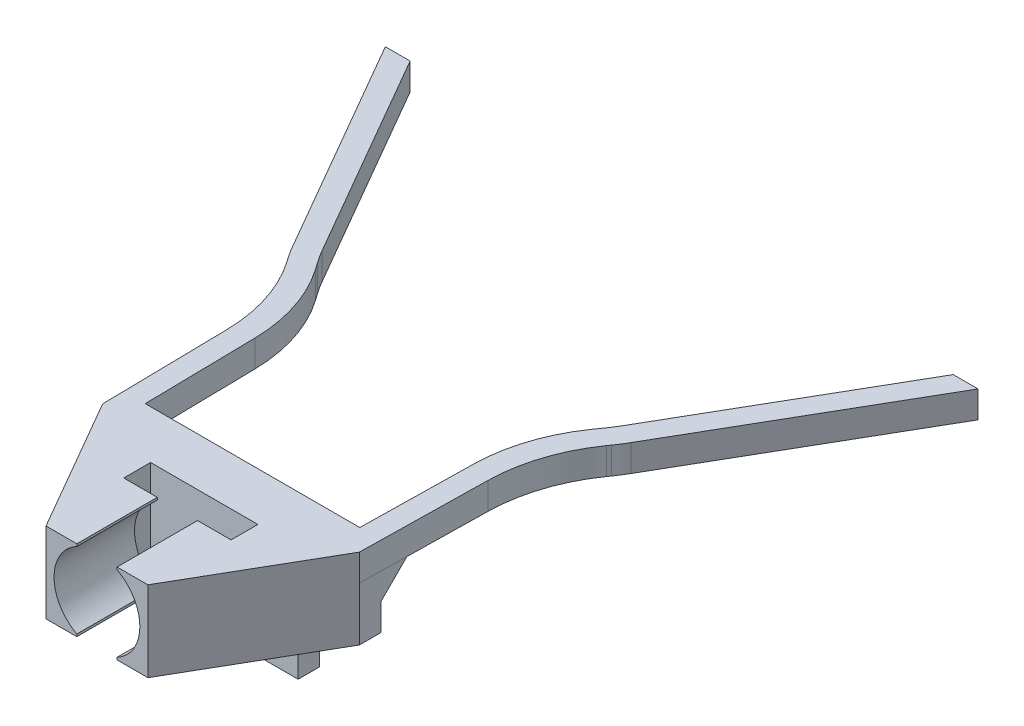
from build123d import *
from OCP.BRepFilletAPI import BRepFilletAPI_MakeChamfer

# Parameters (mm, degrees)
BOSS_EXTRUDE1_DEPTH             = 1
BOSS_EXTRUDE2_REACH             = 42.227
SKETCH2_W                       = 19.144631242
SKETCH2_H                       = 6
BOSS_EXTRUDE2_DIRECTION_2_DEPTH = 10
CUT_EXTRUDE1_DEPTH              = 8
CUT_EXTRUDE2_DEPTH              = 40.207813431
CUT_EXTRUDE2_DEPTH_BACK         = 40.207813431
SKETCH4_W                       = 8
SKETCH4_H                       = 2
CHAMFER1_SIZE                   = 2
CHAMFER2_SIZE                   = 10
CHAMFER2_SIZE2                  = 5.773502692
FILLET1_START                   = -1
FILLET1_DEPTH                   = 3
FILLET1_2_DEPTH                 = 2
BOSS_EXTRUDE3_START             = -6
SKETCH5_W                       = 10
SKETCH5_H                       = 1.6
BOSS_EXTRUDE3_DEPTH             = 10.5


with BuildPart() as part:
    # Sketch1 → Boss-Extrude1 (new, symmetric)
    with BuildSketch(Plane(origin=(0, 0, 0), x_dir=(1, 0, 0), z_dir=(0, 1, 0))):
        Polygon((-8, 0), (0, 0), (0, -1.6), (-9.572315621, -1.6), (-9.800648012, 11.481153904), (-12.360970922, 15.137673965), (-22.096439397, 32), (-20.248918536, 32), (-11.01025903, 15.998172342), (-8.209428877, 11.998172342), align=None)
    boss_extrude1 = extrude(amount=BOSS_EXTRUDE1_DEPTH, both=True)

    # Mirror1: Boss-Extrude1 across plane
    add(boss_extrude1.mirror(Plane(origin=(0, 1, 0), x_dir=(0, 0, 1), z_dir=(-1, 0, 0))))

    # Boss-Extrude2: up to this face of the body (flat: up to its plane)
    boss_extrude2_end = Plane(part.part.faces().sort_by_distance((0, 0, 0))[0])
    # Sketch2 → Boss-Extrude2 (add, up to the picked face)
    with BuildSketch(Plane.XY.offset(1.6), mode=Mode.PRIVATE) as boss_extrude2_sk1:
        with Locations((0, -2)):
            Rectangle(SKETCH2_W, SKETCH2_H)
    boss_extrude2_tool1 = split(extrude(boss_extrude2_sk1.sketch, amount=-BOSS_EXTRUDE2_REACH, mode=Mode.PRIVATE), bisect_by=boss_extrude2_end, keep=Keep.BOTH, mode=Mode.PRIVATE)
    add(boss_extrude2_tool1.solids().sort_by(Axis((0, -2, 1.6), (0, 0, -1)))[0])

    # Sketch2 → Boss-Extrude2 direction 2 (add)
    with BuildSketch(Plane.XY.offset(1.6)):
        with Locations((0, -2)):
            Rectangle(SKETCH2_W, SKETCH2_H)
    extrude(amount=BOSS_EXTRUDE2_DIRECTION_2_DEPTH)

    # Sketch3 → Cut-Extrude1 (cut)
    with BuildSketch(Plane.XY.offset(11.6)):
        with BuildLine():
            Line((-1.5, 0.826658805), (-1.5, 1))
            Line((-1.5, 1), (1.5, 1))
            Line((1.5, 1), (1.5, 0.826658805))
            ThreePointArc((1.5, 0.826658805), (3.2, -2), (1.5, -4.826658805))
            Line((1.5, -4.826658805), (1.5, -5))
            Line((1.5, -5), (-1.5, -5))
            Line((-1.5, -5), (-1.5, -4.826658805))
            ThreePointArc((-1.5, -4.826658805), (-3.2, -2), (-1.5, 0.826658805))
        make_face()
    extrude(amount=-CUT_EXTRUDE1_DEPTH, mode=Mode.SUBTRACT)

    # Sketch4 → Cut-Extrude2 (cut, two sides: drawn at the far end of the back side and taken through both)
    with BuildSketch(Plane(origin=(0, 0, 0), x_dir=(1, 0, 0), z_dir=(0, 1, 0)).offset(-CUT_EXTRUDE2_DEPTH_BACK)):
        with Locations((0, -4.6)):
            Rectangle(SKETCH4_W, SKETCH4_H)
    extrude(amount=CUT_EXTRUDE2_DEPTH + CUT_EXTRUDE2_DEPTH_BACK, mode=Mode.SUBTRACT)

    # Chamfer1
    chamfer1_edges = [part.edges().sort_by_distance(p)[0] for p in [
        (-8.78615781, -1, 0),
        (8.78615781, -1, 0),
    ]]
    chamfer(chamfer1_edges, length=CHAMFER1_SIZE)

    # Chamfer2: one chamfer whose edges measure the first distance from different faces: ONE call of the kernel's chamfer builder (chamfer() names one face for all edges)
    chamfer2_edges_1 = [part.edges().sort_by_distance(p)[0] for p in [
        (9.572315621, -2, 11.6),
    ]]
    chamfer2_side_1 = [part.faces().sort_by_distance(p)[0] for p in [
        (9.572315621, -2.083820663, 5.844834308),
    ]]
    chamfer2_edges_2 = [part.edges().sort_by_distance(p)[0] for p in [
        (-9.572315621, -2, 11.6),
    ]]
    chamfer2_side_2 = [part.faces().sort_by_distance(p)[0] for p in [
        (-9.572315621, -2.083820663, 5.844834308),
    ]]
    chamfer2 = BRepFilletAPI_MakeChamfer(part.part.solid().wrapped)
    for e in chamfer2_edges_1:
        chamfer2.Add(CHAMFER2_SIZE, CHAMFER2_SIZE2, e.wrapped, chamfer2_side_1[0].wrapped)  # the first distance lies on this face
    for e in chamfer2_edges_2:
        chamfer2.Add(CHAMFER2_SIZE, CHAMFER2_SIZE2, e.wrapped, chamfer2_side_2[0].wrapped)  # the first distance lies on this face
    add(Compound.cast(chamfer2.Shape()), mode=Mode.REPLACE)

    # Fillet1: read off the stored shape, not the designer's step
    # Fillet1 outline → Fillet1 (cut)
    with BuildSketch(Plane(origin=(0, 0, 0), x_dir=(1, 0, 0), z_dir=(0, 1, 0)).offset(FILLET1_START)):
        with BuildLine():
            Line((12.360970922, 15.137673965), (12.622936579, 15.591411793))
            ThreePointArc((12.622936579, 15.591411793), (12.351329084, 15.143816493), (12.060456265, 14.708494557))
            Line((12.060456265, 14.708494557), (12.360970922, 15.137673965))
        make_face()
        with BuildLine():
            ThreePointArc((8.145400044, 8.329962936), (8.73089419, 11.828737991), (10.313747854, 15.003451295))
            Line((10.313747854, 15.003451295), (8.209428877, 11.998172342))
            Line((8.209428877, 11.998172342), (8.145400044, 8.329962936))
        make_face()
        with BuildLine():
            Line((-12.360970922, 15.137673965), (-12.060456265, 14.708494557))
            ThreePointArc((-12.060456265, 14.708494557), (-12.351329084, 15.143816493), (-12.622936579, 15.591411793))
            Line((-12.622936579, 15.591411793), (-12.360970922, 15.137673965))
        make_face()
        with BuildLine():
            Line((-8.209428877, 11.998172342), (-10.313747854, 15.003451295))
            ThreePointArc((-10.313747854, 15.003451295), (-8.73089419, 11.828737991), (-8.145400044, 8.329962936))
            Line((-8.145400044, 8.329962936), (-8.209428877, 11.998172342))
        make_face()
    extrude(amount=FILLET1_DEPTH, mode=Mode.SUBTRACT)

    # Fillet1 2 outline → Fillet1 2 (add)
    with BuildSketch(Plane(origin=(0, 0, 0), x_dir=(1, 0, 0), z_dir=(0, 1, 0)).offset(FILLET1_START)):
        with BuildLine():
            ThreePointArc((9.736619178, 7.812944498), (10.322113325, 11.311719553), (11.904966989, 14.486432857))
            Line((11.904966989, 14.486432857), (9.800648012, 11.481153904))
            Line((9.800648012, 11.481153904), (9.736619178, 7.812944498))
        make_face()
        with BuildLine():
            ThreePointArc((11.272224688, 16.45191017), (11.000617192, 16.00431487), (10.709744374, 15.568992934))
            Line((10.709744374, 15.568992934), (11.01025903, 15.998172342))
            Line((11.01025903, 15.998172342), (11.272224688, 16.45191017))
        make_face()
        with BuildLine():
            Line((-9.800648012, 11.481153904), (-11.904966989, 14.486432857))
            ThreePointArc((-11.904966989, 14.486432857), (-10.322113325, 11.311719553), (-9.736619178, 7.812944498))
            Line((-9.736619178, 7.812944498), (-9.800648012, 11.481153904))
        make_face()
        with BuildLine():
            ThreePointArc((-10.709744374, 15.568992934), (-11.000617192, 16.00431487), (-11.272224688, 16.45191017))
            Line((-11.272224688, 16.45191017), (-11.01025903, 15.998172342))
            Line((-11.01025903, 15.998172342), (-10.709744374, 15.568992934))
        make_face()
    extrude(amount=FILLET1_2_DEPTH)

    # Sketch5 → Boss-Extrude3 (add)
    with BuildSketch(Plane.XZ.offset(5).offset(BOSS_EXTRUDE3_START)):
        with Locations((0, 0.8)):
            Rectangle(SKETCH5_W, SKETCH5_H)
    extrude(amount=BOSS_EXTRUDE3_DEPTH)


solid = part.part
